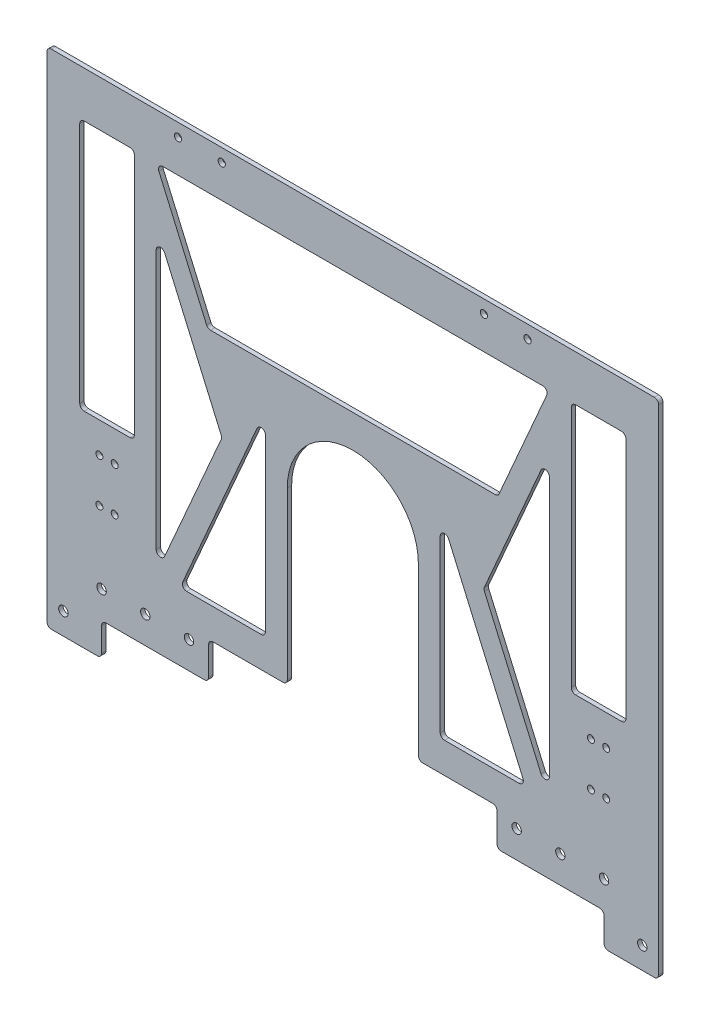
from build123d import *

# Parameters (mm, degrees)
SKETCH_1_W          = 280
SKETCH_1_H          = 230
EXTRUDE_1_DEPTH     = 2
SKETCH_2_R          = 2.15
CUT_EXTRUDE_1_DEPTH = 182.18774793
CUT_EXTRUDE_2_DEPTH = 182.18774793
SKETCH_4_R          = 1.6
CUT_EXTRUDE_3_DEPTH = 182.18774793
SKETCH_5_R          = 1.65
CUT_EXTRUDE_4_DEPTH = 182.18774793
SKETCH_7_W          = 25
SKETCH_7_H          = 115
SKETCH_7_W_2        = 85
SKETCH_7_H_2        = 15
CUT_EXTRUDE_5_DEPTH = 182.18774793
SKETCH_9_W          = 36
SKETCH_9_H          = 17
CUT_EXTRUDE_6_DEPTH = 182.18774793
FILLET_1_R          = 2
FILLET_2_R          = 2


with BuildPart() as part:
    # 草图1 → 凸台-拉伸1 (new body)
    with BuildSketch(Plane.XY):
        Rectangle(SKETCH_1_W, SKETCH_1_H)
    extrude(amount=EXTRUDE_1_DEPTH)

    # 草图2 → 切除-拉伸1 (cut, through all)
    with BuildSketch(Plane.XY.offset(2)):
        with Locations((-132.5, -105)):
            Circle(SKETCH_2_R)
        with Locations((132.5, -105)):
            Circle(SKETCH_2_R)
        with Locations((-115, -87.5)):
            Circle(SKETCH_2_R)
        with Locations((-95, -87.5)):
            Circle(SKETCH_2_R)
        with Locations((-75, -87.5)):
            Circle(SKETCH_2_R)
        with Locations((75, -87.5)):
            Circle(SKETCH_2_R)
        with Locations((95, -87.5)):
            Circle(SKETCH_2_R)
        with Locations((115, -87.5)):
            Circle(SKETCH_2_R)
    extrude(amount=-CUT_EXTRUDE_1_DEPTH, mode=Mode.SUBTRACT)

    # 草图3 → 切除-拉伸2 (cut, through all)
    with BuildSketch(Plane.XY.offset(2)):
        with BuildLine():
            Line((30, -115), (30, -5))
            ThreePointArc((30, -5), (0, 25), (-30, -5))
            Line((-30, -5), (-30, -115))
            Line((-30, -115), (30, -115))
        make_face()
    extrude(amount=-CUT_EXTRUDE_2_DEPTH, mode=Mode.SUBTRACT)

    # 草图4 → 切除-拉伸3 (cut, through all)
    with BuildSketch(Plane.XY.offset(2)):
        with Locations((-109, -35)):
            Circle(SKETCH_4_R)
        with Locations((-109, -55)):
            Circle(SKETCH_4_R)
        with Locations((-116, -35)):
            Circle(SKETCH_4_R)
        with Locations((-116, -55)):
            Circle(SKETCH_4_R)
        with Locations((116, -55)):
            Circle(SKETCH_4_R)
        with Locations((116, -35)):
            Circle(SKETCH_4_R)
        with Locations((109, -55)):
            Circle(SKETCH_4_R)
        with Locations((109, -35)):
            Circle(SKETCH_4_R)
    extrude(amount=-CUT_EXTRUDE_3_DEPTH, mode=Mode.SUBTRACT)

    # 草图5 → 切除-拉伸4 (cut, through all)
    with BuildSketch(Plane.XY.offset(2)):
        with Locations((-60, 109)):
            Circle(SKETCH_5_R)
        with Locations((-80, 109)):
            Circle(SKETCH_5_R)
        with Locations((80, 109)):
            Circle(SKETCH_5_R)
        with Locations((60, 109)):
            Circle(SKETCH_5_R)
    extrude(amount=-CUT_EXTRUDE_4_DEPTH, mode=Mode.SUBTRACT)

    # 草图7 → 切除-拉伸5 (cut, through all)
    with BuildSketch(Plane.XY.offset(2)):
        Polygon((-90, 69), (-90, -69), (-59.885931147, 0), align=None)
        Polygon((-90, 94), (-66.432467855, 40), (66.432467855, 40), (90, 94), align=None)
        Polygon((-40, 20.564392374), (-79.089105488, -69), (-40, -69), align=None)
        Polygon((40, -69), (40, 20.564392374), (79.089105488, -69), align=None)
        Polygon((59.885931147, 0), (90, 69), (90, -69), align=None)
        with Locations((112.5, 36.5)):
            Rectangle(SKETCH_7_W, SKETCH_7_H)
        with Locations((-112.5, 36.5)):
            Rectangle(SKETCH_7_W, SKETCH_7_H)
        with Locations((72.5, -107.5)):
            Rectangle(SKETCH_7_W_2, SKETCH_7_H_2)
        with Locations((-72.5, -107.5)):
            Rectangle(SKETCH_7_W_2, SKETCH_7_H_2)
    extrude(amount=-CUT_EXTRUDE_5_DEPTH, mode=Mode.SUBTRACT)

    # 草图9 → 切除-拉伸6 (cut, through all)
    with BuildSketch(Plane.XY.offset(2)):
        with Locations((48, -91.5)):
            Rectangle(SKETCH_9_W, SKETCH_9_H)
        with Locations((-48, -91.5)):
            Rectangle(SKETCH_9_W, SKETCH_9_H)
    extrude(amount=-CUT_EXTRUDE_6_DEPTH, mode=Mode.SUBTRACT)

    # 圆角1
    fillet_1_edges = [part.edges().sort_by_distance(p)[0] for p in [
        (-90, -69, 1),
        (125, -21, 1),
        (100, -21, 1),
        (100, 94, 1),
        (125, 94, 1),
        (90, 69, 1),
        (90, -69, 1),
        (59.885931147, 0, 1),
        (-100, 94, 1),
        (-100, -21, 1),
        (-125, -21, 1),
        (-125, 94, 1),
        (-90, 94, 1),
        (90, 94, 1),
        (66.432467855, 40, 1),
        (-66.432467855, 40, 1),
        (-40, 20.564392374, 1),
        (-40, -69, 1),
        (-79.089105488, -69, 1),
        (40, 20.564392374, 1),
        (79.089105488, -69, 1),
        (40, -69, 1),
        (-90, 69, 1),
        (-59.885931147, 0, 1),
    ]]
    fillet(fillet_1_edges, radius=FILLET_1_R)

    # 圆角2
    fillet_2_edges = [part.edges().sort_by_distance(p)[0] for p in [
        (-115, -100, 1),
        (-115, -115, 1),
        (-140, -115, 1),
        (140, 115, 1),
        (140, -115, 1),
        (115, -115, 1),
        (115, -100, 1),
        (-140, 115, 1),
        (66, -100, 1),
        (66, -83, 1),
        (30, -83, 1),
        (-66, -100, 1),
        (-30, -83, 1),
        (-66, -83, 1),
    ]]
    fillet(fillet_2_edges, radius=FILLET_2_R)


solid = part.part
